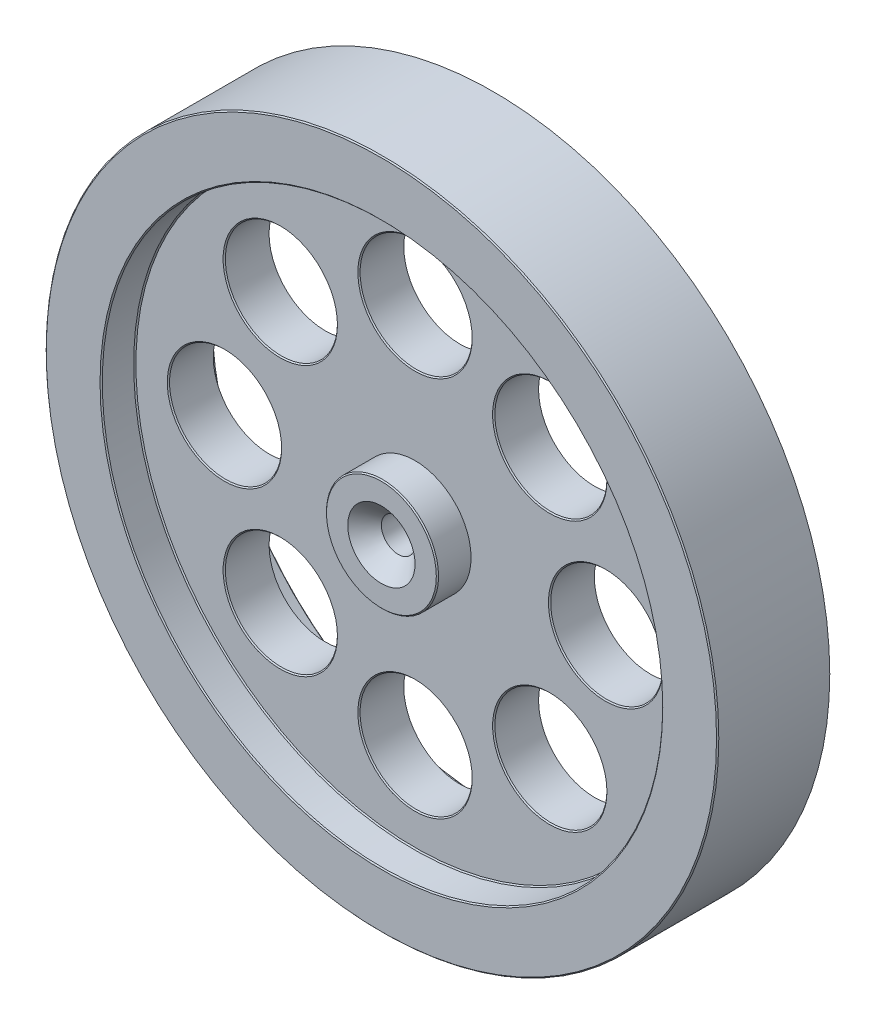
from build123d import *

# Parameters (mm, degrees)
SKETCH2_R           = 30
BOSS_EXTRUDE1_DEPTH = 10
SKETCH3_R           = 25
SKETCH3_R_2         = 5
CUT_EXTRUDE1_DEPTH  = 3
SKETCH4_R           = 5
CUT_EXTRUDE2_DEPTH  = 44
CHAMFER1_SIZE       = 0.1


# Read off the part's stored shape, not the designer's step: Cut-Revolve1
with BuildPart() as part:
    # Sketch2 → Boss-Extrude1 (new body)
    with BuildSketch(Plane.XY):
        Circle(SKETCH2_R)
    extrude(amount=BOSS_EXTRUDE1_DEPTH)

    # Sketch3 → Cut-Extrude1 (cut)
    with BuildSketch(Plane.XY.offset(10)):
        Circle(SKETCH3_R)
        Circle(SKETCH3_R_2, mode=Mode.SUBTRACT)
    cut_extrude1 = extrude(amount=-CUT_EXTRUDE1_DEPTH, mode=Mode.SUBTRACT)

    # Mirror2: Cut-Extrude1 across plane
    add(cut_extrude1.mirror(Plane.XY.offset(5)), mode=Mode.SUBTRACT)

    # Sketch4 → Cut-Extrude2 (cut, through all)
    with BuildSketch(Plane.XY.offset(7)):
        with Locations((0, 17)):
            Circle(SKETCH4_R)
        with Locations((12.02081528, 12.02081528)):
            Circle(SKETCH4_R)
        with Locations((17, 0)):
            Circle(SKETCH4_R)
        with Locations((12.02081528, -12.02081528)):
            Circle(SKETCH4_R)
        with Locations((0, -17)):
            Circle(SKETCH4_R)
        with Locations((-12.02081528, -12.02081528)):
            Circle(SKETCH4_R)
        with Locations((-17, 0)):
            Circle(SKETCH4_R)
        with Locations((-12.02081528, 12.02081528)):
            Circle(SKETCH4_R)
    extrude(amount=-CUT_EXTRUDE2_DEPTH, mode=Mode.SUBTRACT)

    # Chamfer1
    chamfer1_edges = [part.edges().sort_by_distance(p)[0] for p in [
        (-25, 0, 0),
        (-17.02081528, 12.02081528, 7),
        (-22, 0, 7),
        (-17.02081528, -12.02081528, 7),
        (-5, -17, 7),
        (7.02081528, -12.02081528, 7),
        (12, 0, 7),
        (7.02081528, 12.02081528, 7),
        (-5, 17, 7),
        (-30, 0, 10),
        (-25, 0, 7),
        (-25, 0, 10),
        (-5, 0, 10),
    ]]
    chamfer(chamfer1_edges, length=CHAMFER1_SIZE)

    # Cut-Revolve1 outline → Cut-Revolve1 (revolve, cut)
    with BuildSketch(Plane.XZ):
        Polygon((2, 0), (2, 6), (1.5, 6), (1.5, 8.5), (3, 10), (0, 10), (0, 0), align=None)
    revolve(axis=Axis((0, 0, 0), (0, 0, 1)), mode=Mode.SUBTRACT)


solid = part.part
